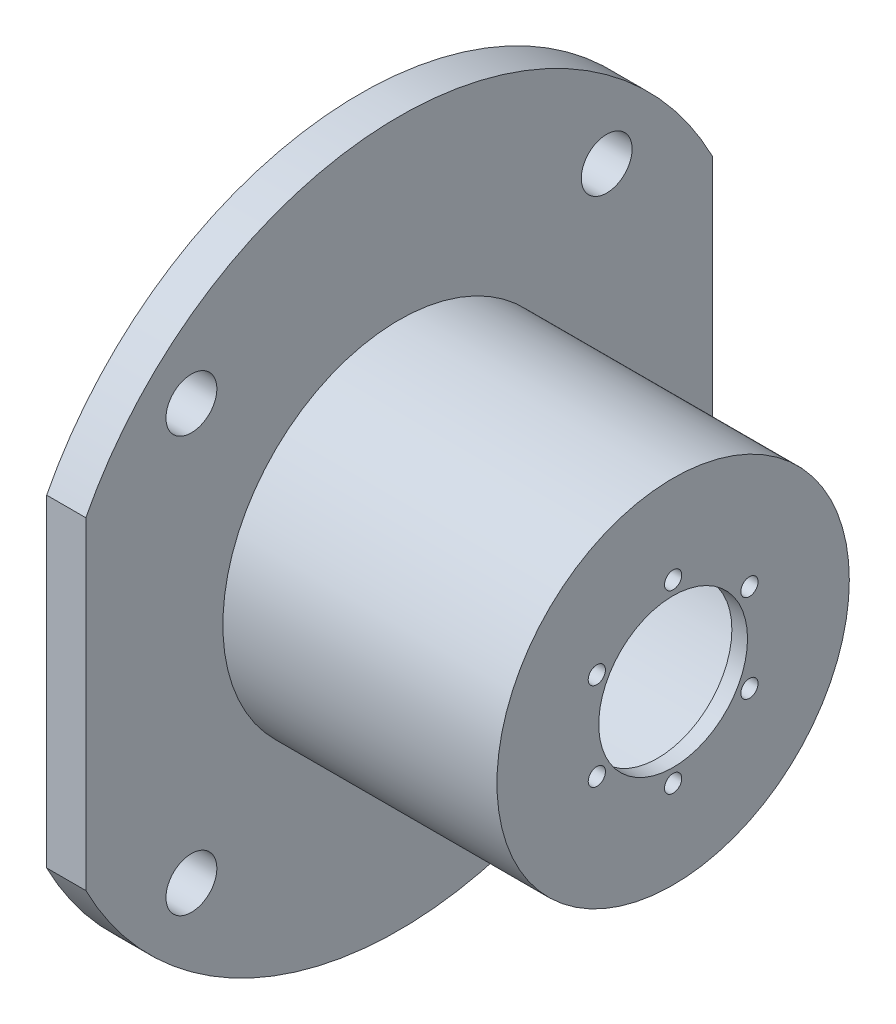
from build123d import *

# Parameters (mm, degrees)
SZKIC2_R                   = 3.25
SZKIC2_R_2                 = 1.1
SZKIC2_W                   = 5
SZKIC2_H                   = 41.231056256
WYTNIJ_WYCI_GNI_CIE1_DEPTH = 76.166481892


with BuildPart() as part:
    # Szkic1 → Obrót1 (revolve)
    with BuildSketch(Plane.XY):
        Polygon((-2, 9.5), (-2, 20), (-40, 20), (-40, 45), (-35, 45), (-35, 22.5), (0, 22.5), (0, 9.5), align=None)
    revolve(axis=Axis((0, 0, 0), (-1, 0, 0)))

    # Szkic2 → Wytnij-wyciągnięcie1 (cut, through all)
    with BuildSketch(Plane(origin=(0, 0, 0), x_dir=(0, 0, -1), z_dir=(1, 0, 0))):
        with Locations((26.516504294, 26.516504294)):
            Circle(SZKIC2_R)
        with Locations((26.516504294, -26.516504294)):
            Circle(SZKIC2_R)
        with Locations((-26.516504294, -26.516504294)):
            Circle(SZKIC2_R)
        with Locations((-26.516504294, 26.516504294)):
            Circle(SZKIC2_R)
        with Locations((0, 11.25)):
            Circle(SZKIC2_R_2)
        with Locations((9.742785793, 5.625)):
            Circle(SZKIC2_R_2)
        with Locations((9.742785793, -5.625)):
            Circle(SZKIC2_R_2)
        with Locations((0, -11.25)):
            Circle(SZKIC2_R_2)
        with Locations((-9.742785793, -5.625)):
            Circle(SZKIC2_R_2)
        with Locations((-9.742785793, 5.625)):
            Circle(SZKIC2_R_2)
        with Locations((-42.5, 0)):
            Rectangle(SZKIC2_W, SZKIC2_H)
        with Locations((42.5, 0)):
            Rectangle(SZKIC2_W, SZKIC2_H)
    extrude(amount=-WYTNIJ_WYCI_GNI_CIE1_DEPTH, mode=Mode.SUBTRACT)


solid = part.part
